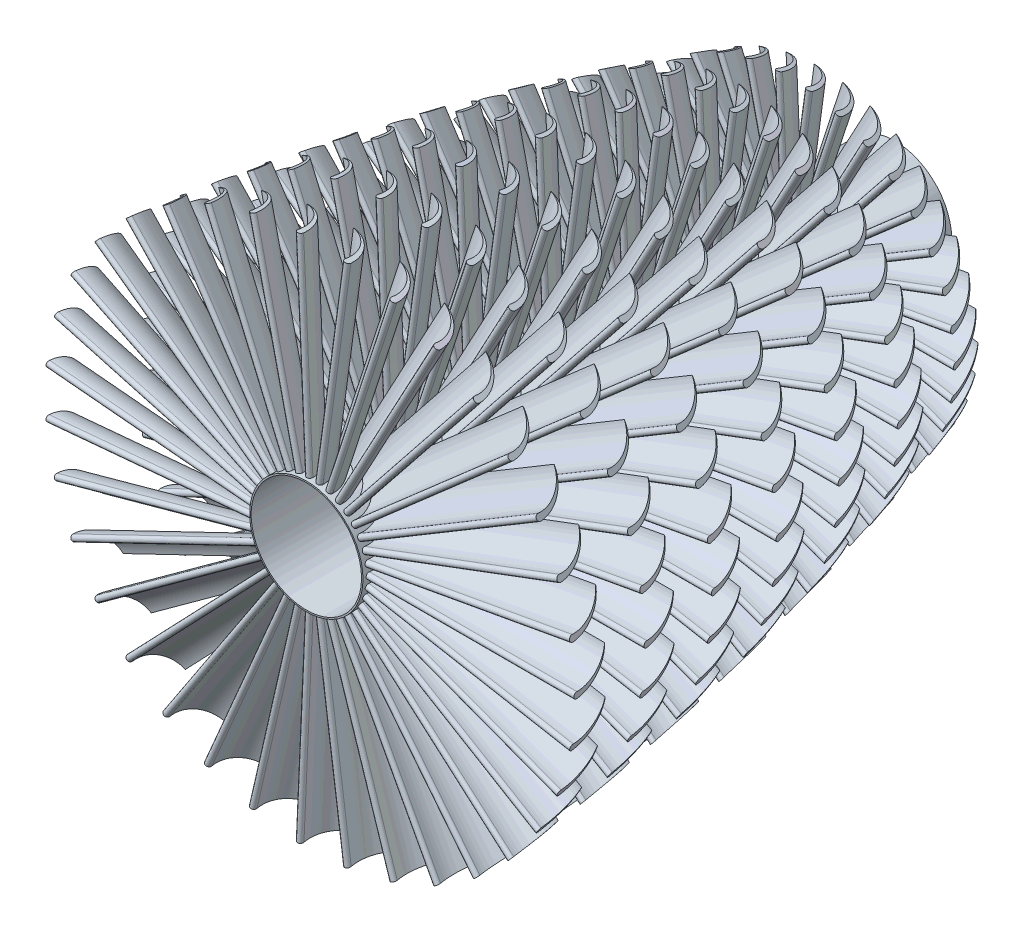
from build123d import *

# Parameters (mm, degrees)
SKETCH2_R                = 7.7
SKETCH2_R_2              = 7.5
EXTRUDE_THIN3_DEPTH      = 80
BOSS_EXTRUDE2_REACH      = 101.642
BOSS_EXTRUDE2_END_RADIUS = 7.7
LPATTERN1_COUNT          = 7
LPATTERN1_PITCH          = 10.75
CIRPATTERN1_COUNT        = 35
CIRPATTERN1_2_COUNT      = 35
CIRPATTERN1_3_COUNT      = 35
CIRPATTERN1_4_COUNT      = 35
CIRPATTERN1_5_COUNT      = 35
CIRPATTERN1_6_COUNT      = 35
CIRPATTERN1_7_COUNT      = 35


with BuildPart() as part:
    # Sketch2 → Extrude-Thin3 (new body)
    with BuildSketch(Plane.XY):
        Circle(SKETCH2_R)
        Circle(SKETCH2_R_2, mode=Mode.SUBTRACT)
    extrude(amount=EXTRUDE_THIN3_DEPTH)


with BuildPart() as body_2:
    # Boss-Extrude2: up to this cylinder (the profile starts outside it)
    boss_extrude2_end = Plane(origin=(0, 0, 77.462511), z_dir=(0, 0, -1)) * Cylinder(BOSS_EXTRUDE2_END_RADIUS, 219.684, mode=Mode.PRIVATE)
    # Sketch4 → Boss-Extrude2 (new, up to the surface)
    with BuildSketch(Plane(origin=(51.2, 0, 0), x_dir=(0, 0, -1), z_dir=(1, 0, 0)), mode=Mode.PRIVATE) as boss_extrude2_sk1:
        with BuildLine():
            Line((-74.714449969, 3.649069007), (-74.714449969, 3.459069007))
            ThreePointArc((-74.714449969, 3.459069007), (-76.219507623, 0.692266236), (-79.17, -0.41))
            ThreePointArc((-79.17, -0.41), (-79.57927684, 0.024340677), (-79.12140451, 0.407109909))
            ThreePointArc((-79.12140451, 0.407109909), (-76.277004224, 1.156851264), (-74.714449969, 3.649069007))
        make_face()
    boss_extrude2_tool1 = extrude(boss_extrude2_sk1.sketch, amount=-BOSS_EXTRUDE2_REACH, mode=Mode.PRIVATE) - boss_extrude2_end
    add(boss_extrude2_tool1.solids().sort_by_distance((51.2, 0.539854, 77.462511))[0])


with BuildPart() as lpattern1_1:
    # LPattern1: pattern copy
    add(body_2.part.moved(Location(Vector(0, 0, -1) * (1 * LPATTERN1_PITCH))))


with BuildPart() as lpattern1_2:
    # LPattern1: pattern copy
    add(body_2.part.moved(Location(Vector(0, 0, -1) * (2 * LPATTERN1_PITCH))))


with BuildPart() as lpattern1_3:
    # LPattern1: pattern copy
    add(body_2.part.moved(Location(Vector(0, 0, -1) * (3 * LPATTERN1_PITCH))))


with BuildPart() as lpattern1_4:
    # LPattern1: pattern copy
    add(body_2.part.moved(Location(Vector(0, 0, -1) * (4 * LPATTERN1_PITCH))))


with BuildPart() as lpattern1_5:
    # LPattern1: pattern copy
    add(body_2.part.moved(Location(Vector(0, 0, -1) * (5 * LPATTERN1_PITCH))))


with BuildPart() as lpattern1_6:
    # LPattern1: pattern copy
    add(body_2.part.moved(Location(Vector(0, 0, -1) * (6 * LPATTERN1_PITCH))))


with BuildPart() as cut_revolve1_tool:
    # Sketch5 → Cut-Revolve1 (revolve)
    with BuildSketch(Plane(origin=(0, 0, 0), x_dir=(1, 0, 0), z_dir=(0, 1, 0))):
        with BuildLine():
            Line((18, 0), (73.417806087, 0))
            Line((73.417806087, 0), (73.417806087, -83.490230195))
            Line((73.417806087, -83.490230195), (36.3, -83.490230195))
            ThreePointArc((36.3, -83.490230195), (29.85548528, -41.152107023), (18, 0))
        make_face()
    revolve(axis=Axis((0, 0, 0), (0, 0, 1)))


with BuildPart() as body_2_1:
    add(body_2.part)

    # Cut-Revolve1: cut by cut_revolve1_tool
    add(cut_revolve1_tool.part, mode=Mode.SUBTRACT)

    # CirPattern1: body 2 ×35 about axis
    cirpattern1_axis = Axis((0, 0, 0), (0, 0, 1))


with BuildPart() as lpattern1_1_1:
    add(lpattern1_1.part)

    # Cut-Revolve1: cut by cut_revolve1_tool
    add(cut_revolve1_tool.part, mode=Mode.SUBTRACT)

    # CirPattern1 2: LPattern1_1 ×35 about axis
    cirpattern1_2_axis = Axis((0, 0, 0), (0, 0, 1))


with BuildPart() as lpattern1_2_1:
    add(lpattern1_2.part)

    # Cut-Revolve1: cut by cut_revolve1_tool
    add(cut_revolve1_tool.part, mode=Mode.SUBTRACT)

    # CirPattern1 3: LPattern1_2 ×35 about axis
    cirpattern1_3_axis = Axis((0, 0, 0), (0, 0, 1))


with BuildPart() as lpattern1_3_1:
    add(lpattern1_3.part)

    # Cut-Revolve1: cut by cut_revolve1_tool
    add(cut_revolve1_tool.part, mode=Mode.SUBTRACT)

    # CirPattern1 4: LPattern1_3 ×35 about axis
    cirpattern1_4_axis = Axis((0, 0, 0), (0, 0, 1))


with BuildPart() as lpattern1_4_1:
    add(lpattern1_4.part)

    # Cut-Revolve1: cut by cut_revolve1_tool
    add(cut_revolve1_tool.part, mode=Mode.SUBTRACT)

    # CirPattern1 5: LPattern1_4 ×35 about axis
    cirpattern1_5_axis = Axis((0, 0, 0), (0, 0, 1))


with BuildPart() as lpattern1_5_1:
    add(lpattern1_5.part)

    # Cut-Revolve1: cut by cut_revolve1_tool
    add(cut_revolve1_tool.part, mode=Mode.SUBTRACT)

    # CirPattern1 6: LPattern1_5 ×35 about axis
    cirpattern1_6_axis = Axis((0, 0, 0), (0, 0, 1))


with BuildPart() as lpattern1_6_1:
    add(lpattern1_6.part)

    # Cut-Revolve1: cut by cut_revolve1_tool
    add(cut_revolve1_tool.part, mode=Mode.SUBTRACT)

    # CirPattern1 7: LPattern1_6 ×35 about axis
    cirpattern1_7_axis = Axis((0, 0, 0), (0, 0, 1))


with BuildPart() as body_2_2:
    add(body_2_1.part)
    for i in range(1, CIRPATTERN1_COUNT):
        add(body_2_1.part.rotate(cirpattern1_axis, i * 360 / CIRPATTERN1_COUNT))


with BuildPart() as lpattern1_1_2:
    add(lpattern1_1_1.part)
    for i in range(1, CIRPATTERN1_2_COUNT):
        add(lpattern1_1_1.part.rotate(cirpattern1_2_axis, i * 360 / CIRPATTERN1_2_COUNT))


with BuildPart() as lpattern1_2_2:
    add(lpattern1_2_1.part)
    for i in range(1, CIRPATTERN1_3_COUNT):
        add(lpattern1_2_1.part.rotate(cirpattern1_3_axis, i * 360 / CIRPATTERN1_3_COUNT))


with BuildPart() as lpattern1_3_2:
    add(lpattern1_3_1.part)
    for i in range(1, CIRPATTERN1_4_COUNT):
        add(lpattern1_3_1.part.rotate(cirpattern1_4_axis, i * 360 / CIRPATTERN1_4_COUNT))


with BuildPart() as lpattern1_4_2:
    add(lpattern1_4_1.part)
    for i in range(1, CIRPATTERN1_5_COUNT):
        add(lpattern1_4_1.part.rotate(cirpattern1_5_axis, i * 360 / CIRPATTERN1_5_COUNT))


with BuildPart() as lpattern1_5_2:
    add(lpattern1_5_1.part)
    for i in range(1, CIRPATTERN1_6_COUNT):
        add(lpattern1_5_1.part.rotate(cirpattern1_6_axis, i * 360 / CIRPATTERN1_6_COUNT))


with BuildPart() as lpattern1_6_2:
    add(lpattern1_6_1.part)
    for i in range(1, CIRPATTERN1_7_COUNT):
        add(lpattern1_6_1.part.rotate(cirpattern1_7_axis, i * 360 / CIRPATTERN1_7_COUNT))


solid = Compound([part.part, body_2_2.part, lpattern1_1_2.part, lpattern1_2_2.part, lpattern1_3_2.part, lpattern1_4_2.part, lpattern1_5_2.part, lpattern1_6_2.part])
